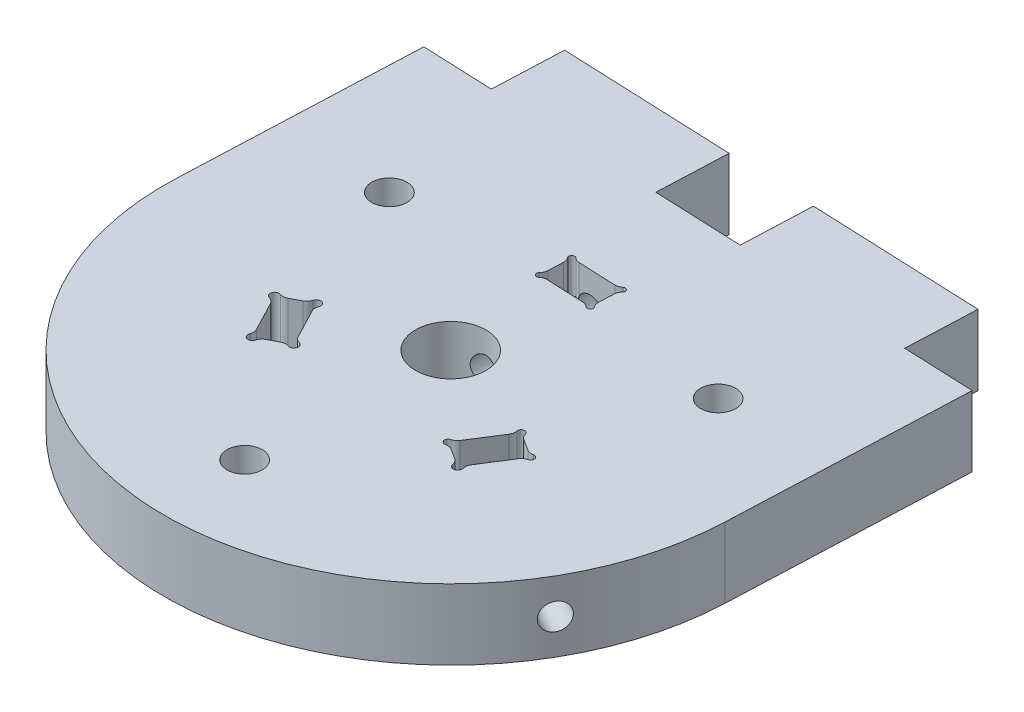
from build123d import *
from build123d.topology import SkipClean

# Parameters (mm, degrees)
SKETCH1_R           = 4
SKETCH1_R_2         = 2
BOSS_EXTRUDE2_DEPTH = 8
FILLET4_R           = 1
SKETCH4_R           = 1.5
CUT_EXTRUDE1_DEPTH  = 29
CIRPATTERN1_COUNT   = 3
BOSS_EXTRUDE3_DEPTH = 8
SKETCH9_W           = 8
SKETCH9_H           = 8
CUT_EXTRUDE2_DEPTH  = 8


with BuildPart() as part:
    # Sketch1 → Boss-Extrude2 (new body)
    with BuildSketch(Plane(origin=(0, 0, 0), x_dir=(1, 0, 0), z_dir=(0, 1, 0))):
        with BuildLine():
            ThreePointArc((32.5, 0), (-7.764696895, 31.558825741), (-28.789814285, -15.079674845))
            ThreePointArc((-28.789814285, -15.079674845), (7.764696895, -31.558825741), (32.5, 0))
        make_face()
        with BuildLine():
            ThreePointArc((1.075405322, -22.480994744), (-1.959978669, -24.192128868), (-1.852574668, -20.709313865))
            ThreePointArc((-1.852574668, -20.709313865), (0.110789313, -20.76986062), (1.075405322, -22.480994744))
        make_face(mode=Mode.SUBTRACT)
        with BuildLine():
            Line((-12.011520372, -3.469276343), (-10.851545384, -5.683877442))
            Line((-10.851545384, -5.683877442), (-9.691570396, -7.89847854))
            ThreePointArc((-9.691570396, -7.89847854), (-9.200729401, -7.913615229), (-8.959575399, -8.34139876))
            ThreePointArc((-8.959575399, -8.34139876), (-9.340118523, -8.826919156), (-9.902495618, -8.573393758))
            Line((-9.902495618, -8.573393758), (-12.117096717, -9.733368746))
            ThreePointArc((-12.117096717, -9.733368746), (-12.074496541, -9.845906868), (-12.060016937, -9.965363744))
            ThreePointArc((-12.060016937, -9.965363744), (-12.818862935, -10.393147275), (-12.792011935, -9.522443524))
            Line((-12.792011935, -9.522443524), (-13.951986923, -7.307842425))
            Line((-13.951986923, -7.307842425), (-15.111961911, -5.093241326))
            ThreePointArc((-15.111961911, -5.093241326), (-15.821194035, -4.501174451), (-14.901036689, -4.418326109))
            Line((-14.901036689, -4.418326109), (-12.68643559, -3.258351121))
            ThreePointArc((-12.68643559, -3.258351121), (-12.362972245, -2.540835727), (-11.74351537, -3.026356123))
            ThreePointArc((-11.74351537, -3.026356123), (-11.815731839, -3.285202121), (-12.011520372, -3.469276343))
        make_face(mode=Mode.SUBTRACT)
        with BuildLine():
            Line((9.105768427, -8.833802486), (10.495173041, -6.640656187))
            Line((10.495173041, -6.640656187), (11.884577655, -4.447509889))
            ThreePointArc((11.884577655, -4.447509889), (11.906005888, -3.75265147), (12.504453339, -4.106414159))
            ThreePointArc((12.504453339, -4.106414159), (12.488464639, -4.218914535), (12.441764751, -4.322505526))
            Line((12.441764751, -4.322505526), (14.716188991, -5.763401436))
            ThreePointArc((14.716188991, -5.763401436), (15.169785096, -5.591697185), (15.461069039, -5.979492803))
            ThreePointArc((15.461069039, -5.979492803), (15.251947853, -6.333255492), (14.841193354, -6.320588532))
            Line((14.841193354, -6.320588532), (12.113875424, -10.625603188))
            ThreePointArc((12.113875424, -10.625603188), (12.284351736, -10.806928453), (12.34629276, -11.047976859))
            ThreePointArc((12.34629276, -11.047976859), (11.706985251, -11.528178294), (11.423919089, -10.780394196))
            Line((11.423919089, -10.780394196), (9.23077279, -9.390989582))
            ThreePointArc((9.23077279, -9.390989582), (8.495686287, -9.263289649), (9.105768427, -8.833802486))
        make_face(mode=Mode.SUBTRACT)
        with BuildLine():
            ThreePointArc((-17.006815212, 12.041219851), (-17.295681088, 11.00583586), (-18.078835221, 10.269538972))
            ThreePointArc((-18.078835221, 10.269538972), (-20.717949336, 13.076603843), (-17.006815212, 12.041219851))
        make_face(mode=Mode.SUBTRACT)
        Circle(SKETCH1_R, mode=Mode.SUBTRACT)
        with BuildLine():
            Line((3.311397597, 12.215092906), (0.650408528, 12.324533629))
            Line((0.650408528, 12.324533629), (-2.010580541, 12.433974353))
            ThreePointArc((-2.010580541, 12.433974353), (-2.594767878, 12.219673168), (-2.333218871, 12.784289816))
            Line((-2.333218871, 12.784289816), (-2.217070166, 15.608379649))
            ThreePointArc((-2.217070166, 15.608379649), (-2.436413839, 16.187826197), (-1.866470247, 15.944856546))
            ThreePointArc((-1.866470247, 15.944856546), (-1.866541369, 15.937935801), (-1.866754702, 15.93101798))
            Line((-1.866754702, 15.93101798), (3.455223436, 15.712136532))
            ThreePointArc((3.455223436, 15.712136532), (3.798621078, 16.034988196), (4.128461684, 15.698297966))
            ThreePointArc((4.128461684, 15.698297966), (4.024882572, 15.455328315), (3.777861766, 15.361821069))
            Line((3.777861766, 15.361821069), (3.661713061, 12.537731236))
            ThreePointArc((3.661713061, 12.537731236), (3.890844145, 12.434436578), (3.984635846, 12.201254339))
            ThreePointArc((3.984635846, 12.201254339), (3.640953749, 11.864564108), (3.311397597, 12.215092906))
        make_face(mode=Mode.SUBTRACT)
        with Locations((19.93140989, 10.439774893)):
            Circle(SKETCH1_R_2, mode=Mode.SUBTRACT)
    extrude(amount=BOSS_EXTRUDE2_DEPTH)

    # Fillet4
    fillet4_edges = [part.edges().sort_by_distance(p)[0] for p in [
        (-14.901036689, 4, 4.418326109),
        (-12.011520372, 4, 3.469276343),
        (-12.68643559, 4, 3.258351121),
        (-15.111961911, 4, 5.093241326),
        (-12.792011935, 4, 9.522443524),
        (-12.117096717, 4, 9.733368746),
        (-9.902495618, 4, 8.573393758),
        (-9.691570396, 4, 7.89847854),
        (11.423919089, 4, 10.780394196),
        (12.113875424, 4, 10.625603188),
        (9.105768427, 4, 8.833802486),
        (9.23077279, 4, 9.390989582),
        (14.841193354, 4, 6.320588532),
        (14.716188991, 4, 5.763401436),
        (12.441764751, 4, 4.322505526),
        (11.884577655, 4, 4.447509889),
        (3.661713061, 4, -12.537731236),
        (3.311397597, 4, -12.215092906),
        (-2.010580541, 4, -12.433974353),
        (-2.333218871, 4, -12.784289816),
        (-2.217070166, 4, -15.608379649),
        (-1.866754702, 4, -15.93101798),
        (3.455223436, 4, -15.712136532),
        (3.777861766, 4, -15.361821069),
    ]]
    fillet(fillet4_edges, radius=FILLET4_R)

    # Sketch4 → Cut-Extrude1 (cut)
    with BuildSketch(Plane(origin=(0, 8, -32.5), x_dir=(-1, 0, 0), z_dir=(0, 0, -1))):
        with Locations((0, -4)):
            Circle(SKETCH4_R)
    cut_extrude1 = extrude(amount=-CUT_EXTRUDE1_DEPTH, mode=Mode.SUBTRACT)

    # CirPattern1: Cut-Extrude1 ×3 about axis
    with SkipClean():  # the faces are left unmerged after this step: merging them gives an invalid solid
        cirpattern1_axis = Axis((0, 8, 0), (0, 1, 0))
        for i in range(1, CIRPATTERN1_COUNT):
            add(cut_extrude1.rotate(cirpattern1_axis, i * 360 / CIRPATTERN1_COUNT), mode=Mode.SUBTRACT)

    # Sketch6 → Boss-Extrude3 (add)
    with BuildSketch(Plane.XZ):
        with BuildLine():
            Line((33.910806351, -33.634910623), (32.472547964, 1.335525646))
            ThreePointArc((32.472547964, 1.335525646), (32.493136266, 0.667903879), (32.5, 0))
            ThreePointArc((32.5, 0), (0.667903879, -32.493136266), (-32.472547964, -1.335525646))
            Line((-32.472547964, -1.335525646), (-31.034289576, -36.305961914))
            Line((-31.034289576, -36.305961914), (33.910806351, -33.634910623))
        make_face()
    extrude(amount=-BOSS_EXTRUDE3_DEPTH)

    # Sketch9 → Cut-Extrude2 (cut)
    with BuildSketch(Plane(origin=(1.438258388, 0, -34.970436269), x_dir=(-0.9991553219574474, 0, -0.041093096793860265), z_dir=(0.041093096793860265, 0, -0.9991553219574474))):
        Polygon((0, 8), (5, 8), (5, 0), (-5, 0), (-5, 8), align=None)
        with Locations((28.5, 4)):
            Rectangle(SKETCH9_W, SKETCH9_H)
        with Locations((-28.5, 4)):
            Rectangle(SKETCH9_W, SKETCH9_H)
    extrude(amount=-CUT_EXTRUDE2_DEPTH, mode=Mode.SUBTRACT)


solid = part.part
